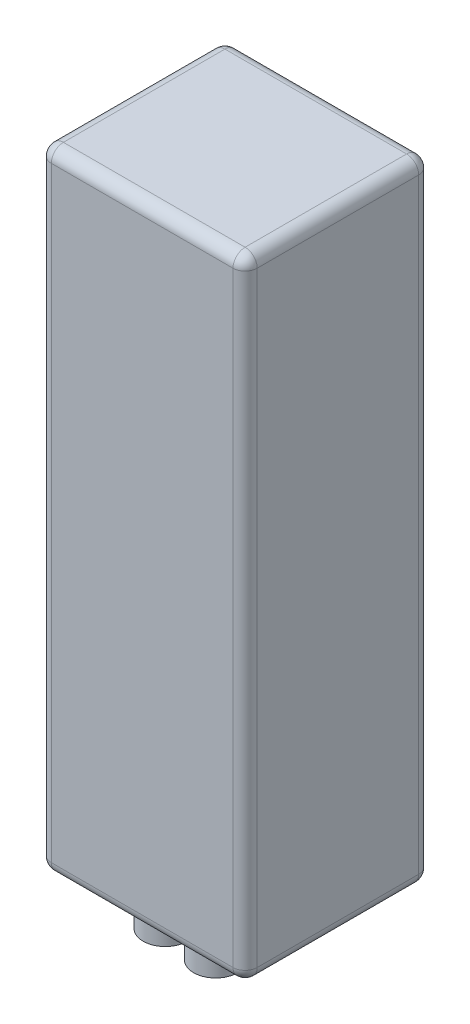
from build123d import *

# Parameters (mm, degrees)
SKETCH1_W           = 51
SKETCH1_H           = 46
BOSS_EXTRUDE1_DEPTH = 156
FILLET1_R           = 3
SKETCH2_R           = 5.479665814
BOSS_EXTRUDE2_DEPTH = 10


with BuildPart() as part:
    # Sketch1 → Boss-Extrude1 (new body)
    with BuildSketch(Plane(origin=(0, 0, 0), x_dir=(1, 0, 0), z_dir=(0, 1, 0))):
        with Locations((-13.995554746, -2.3)):
            Rectangle(SKETCH1_W, SKETCH1_H)
    extrude(amount=BOSS_EXTRUDE1_DEPTH)

    # Fillet1
    fillet1_edges = [part.edges().sort_by_distance(p)[0] for p in [
        (11.504445254, 0, 2.3),
        (11.504445254, 156, 2.3),
        (-39.495554746, 156, 2.3),
        (-39.495554746, 0, 2.3),
        (11.504445254, 78, -20.7),
        (-13.995554746, 156, -20.7),
        (-39.495554746, 78, -20.7),
        (-13.995554746, 0, -20.7),
        (-39.495554746, 78, 25.3),
        (-13.995554746, 156, 25.3),
        (11.504445254, 78, 25.3),
        (-13.995554746, 0, 25.3),
    ]]
    fillet(fillet1_edges, radius=FILLET1_R)

    # Sketch2 → Boss-Extrude2 (add)
    with BuildSketch(Plane.XZ):
        with Locations((-21.241241136, 12.3252816)):
            Circle(SKETCH2_R)
        with Locations((-8.248975885, 12.82498411)):
            Circle(SKETCH2_R)
    extrude(amount=BOSS_EXTRUDE2_DEPTH)


solid = part.part
